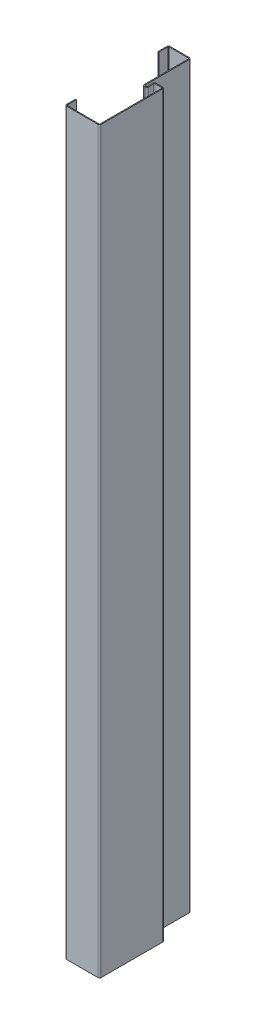
from build123d import *

# Parameters (mm, degrees)
BASE_FLANGE1_DEPTH = 490.75


# Sheet-metal steps are written as plain solids
with BuildPart() as part:
    # Sketch1 → Base-Flange1 (new, symmetric)
    with BuildSketch(Plane(origin=(0, 0, 0), x_dir=(1, 0, 0), z_dir=(0, 1, 0))):
        with BuildLine():
            Line((9.5, 55.75), (9.5, 67.7634))
            ThreePointArc((9.5, 67.7634), (10.081861668, 69.168138332), (11.4866, 69.75))
            Line((11.4866, 69.75), (37.5134, 69.75))
            ThreePointArc((37.5134, 69.75), (38.918138332, 69.168138332), (39.5, 67.7634))
            Line((39.5, 67.7634), (39.5, 18.25))
            Line((39.5, 18.25), (39.5, 8.562771629))
            ThreePointArc((39.5, 8.562771629), (39.724914644, 8.032905932), (40.262306969, 7.826620346))
            Line((40.262306969, 7.826620346), (42.153527557, 7.892663224))
            ThreePointArc((42.153527557, 7.892663224), (42.675221066, 8.135932903), (42.862626267, 8.680197126))
            Line((42.862626267, 8.680197126), (42.359529101, 15.874821789))
            ThreePointArc((42.359529101, 15.874821789), (42.88838258, 17.368257942), (44.341289843, 18))
            Line((44.341289843, 18), (53.5134, 18))
            ThreePointArc((53.5134, 18), (54.918138332, 17.418138332), (55.5, 16.0134))
            Line((55.5, 16.0134), (55.5, -20.75))
            Line((55.5, -20.75), (55.5, -65.7634))
            ThreePointArc((55.5, -65.7634), (54.918138332, -67.168138332), (53.5134, -67.75))
            Line((53.5134, -67.75), (39.5, -67.75))
            Line((39.5, -67.75), (11.4866, -67.75))
            ThreePointArc((11.4866, -67.75), (10.081861668, -67.168138332), (9.5, -65.7634))
            Line((9.5, -65.7634), (9.5, -53.75))
            Line((9.5, -53.75), (10.75, -53.75))
            Line((10.75, -53.75), (10.75, -65.7634))
            ThreePointArc((10.75, -65.7634), (10.965745145, -66.284254855), (11.4866, -66.5))
            Line((11.4866, -66.5), (39.5, -66.5))
            Line((39.5, -66.5), (53.5134, -66.5))
            ThreePointArc((53.5134, -66.5), (54.034254855, -66.284254855), (54.25, -65.7634))
            Line((54.25, -65.7634), (54.25, -20.75))
            Line((54.25, -20.75), (54.25, 16.0134))
            ThreePointArc((54.25, 16.0134), (54.034254855, 16.534254855), (53.5134, 16.75))
            Line((53.5134, 16.75), (44.341289843, 16.75))
            ThreePointArc((44.341289843, 16.75), (43.802574707, 16.515759992), (43.606484164, 15.962017381))
            Line((43.606484164, 15.962017381), (44.10958133, 8.767392718))
            ThreePointArc((44.10958133, 8.767392718), (43.604152098, 7.299519645), (42.197151928, 6.64342469))
            Line((42.197151928, 6.64342469), (40.30593134, 6.577381812))
            ThreePointArc((40.30593134, 6.577381812), (38.856591681, 7.133731182), (38.25, 8.562771629))
            Line((38.25, 8.562771629), (38.25, 18.25))
            Line((38.25, 18.25), (38.25, 67.7634))
            ThreePointArc((38.25, 67.7634), (38.034254855, 68.284254855), (37.5134, 68.5))
            Line((37.5134, 68.5), (11.4866, 68.5))
            ThreePointArc((11.4866, 68.5), (10.965745145, 68.284254855), (10.75, 67.7634))
            Line((10.75, 67.7634), (10.75, 55.75))
            Line((10.75, 55.75), (9.5, 55.75))
        make_face()
    extrude(amount=BASE_FLANGE1_DEPTH, both=True)


solid = part.part
